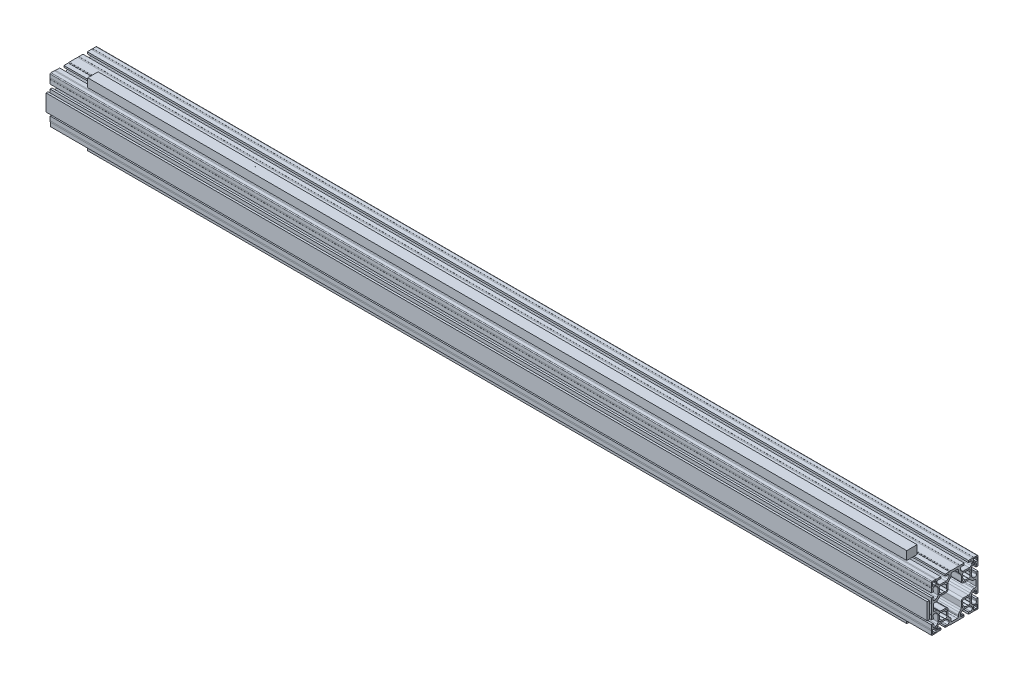
from build123d import *

# Parameters (mm, degrees)
ESQUISSE1_W             = 4
ESQUISSE1_H             = 32
BOSS_EXTRU_1_DEPTH      = 1700
BOSS_EXTRU_1_2_DEPTH    = 1700
ESQUISSE2_W             = 20
ESQUISSE2_H             = 16.5
ENL_V_MAT_EXTRU_1_DEPTH = 60
ESQUISSE3_W             = 20
ESQUISSE3_H             = 16.5
ENL_V_MAT_EXTRU_2_DEPTH = 60


with BuildPart() as part:
    # Esquisse1 → Boss.-Extru.1 (new body)
    with BuildSketch(Plane.ZY):
        with Locations((-16.500000003, -1e-08)):
            Rectangle(ESQUISSE1_W, ESQUISSE1_H)
    extrude(amount=BOSS_EXTRU_1_DEPTH)


with BuildPart() as body_2:
    # Esquisse1 → Boss.-Extru.1 2 (new body)
    with BuildSketch(Plane.ZY):
        with BuildLine():
            Line((-35.000000052, -61.000000011), (-35.000000052, -44.500000011))
            Line((-35.000000052, -44.500000011), (-32.499899985, -44.500000011))
            Line((-32.499899985, -44.500000011), (-32.499899985, -44.850000011))
            Line((-32.499899985, -44.850000011), (-30.499999985, -44.850000011))
            Line((-30.499999985, -44.850000011), (-30.499999985, -45.000000035))
            Line((-30.499999985, -45.000000035), (-23.999999985, -45.000000035))
            ThreePointArc((-23.999999985, -45.000000035), (-23.46492799, -44.901320113), (-23.000257146, -44.618263983))
            Line((-23.000257146, -44.618263983), (-23.000257146, -37.000000035))
            Line((-23.000257146, -37.000000035), (-22.649999985, -37.000000035))
            Line((-22.649999985, -37.000000035), (-22.649999985, -34.500000035))
            Line((-22.649999985, -34.500000035), (-22.499999985, -34.500000035))
            Line((-22.499999985, -34.500000035), (-22.499999985, -26.600000035))
            Line((-22.499999985, -26.600000035), (-26.200199985, -26.600000035))
            Line((-26.200199985, -26.600000035), (-26.200199985, -29.075000035))
            Line((-26.200199985, -29.075000035), (-26.000199985, -29.075000035))
            ThreePointArc((-26.000199985, -29.075000035), (-25.646646594, -29.221446645), (-25.500199985, -29.575000035))
            Line((-25.500199985, -29.575000035), (-25.500199985, -31.000000035))
            ThreePointArc((-25.500199985, -31.000000035), (-26.378879641, -33.121320379), (-28.500199985, -34.000000035))
            Line((-28.500199985, -34.000000035), (-30.550299985, -34.000000035))
            ThreePointArc((-30.550299985, -34.000000035), (-31.315632123, -33.847773485), (-31.964449526, -33.414250496))
            Line((-31.964449526, -33.414250496), (-33.735599986, -31.643100036))
            ThreePointArc((-33.735599986, -31.643100036), (-34.819416002, -30.020972887), (-35.199999986, -28.107570295))
            Line((-35.199999986, -28.107570295), (-35.199999986, -16.892400036))
            ThreePointArc((-35.199999986, -16.892400036), (-34.819300524, -14.978748396), (-33.735254217, -13.356454253))
            Line((-33.735254217, -13.356454253), (-31.964500003, -11.585800019))
            ThreePointArc((-31.964500003, -11.585800019), (-31.315676681, -11.152245019), (-30.550325061, -11.000000019))
            Line((-30.550325061, -11.000000019), (-28.500200003, -11.000000019))
            ThreePointArc((-28.500200003, -11.000000019), (-26.378879659, -11.878679675), (-25.500200003, -14.000000019))
            Line((-25.500200003, -14.000000019), (-25.500200003, -15.425000019))
            ThreePointArc((-25.500200003, -15.425000019), (-25.646646612, -15.77855341), (-26.000200003, -15.925000019))
            Line((-26.000200003, -15.925000019), (-26.200200003, -15.925000019))
            Line((-26.200200003, -15.925000019), (-26.200200003, -18.400000019))
            Line((-26.200200003, -18.400000019), (-22.500000003, -18.400000019))
            Line((-22.500000003, -18.400000019), (-22.500000003, -10.500000019))
            Line((-22.500000003, -10.500000019), (-22.650000003, -10.500000019))
            Line((-22.650000003, -10.500000019), (-22.650000003, -8.000000019))
            Line((-22.650000003, -8.000000019), (-22.500000003, -8.000000019))
            Line((-22.500000003, -8.000000019), (-22.500000003, 7.999999981))
            Line((-22.500000003, 7.999999981), (-22.650000003, 7.999999981))
            Line((-22.650000003, 7.999999981), (-22.650000003, 10.499999981))
            Line((-22.650000003, 10.499999981), (-22.500000003, 10.499999981))
            Line((-22.500000003, 10.499999981), (-22.500000003, 18.399999981))
            Line((-22.500000003, 18.399999981), (-26.200200003, 18.399999981))
            Line((-26.200200003, 18.399999981), (-26.200200003, 15.924999981))
            Line((-26.200200003, 15.924999981), (-26.000200003, 15.924999981))
            ThreePointArc((-26.000200003, 15.924999981), (-25.646646612, 15.778553372), (-25.500200003, 15.424999981))
            Line((-25.500200003, 15.424999981), (-25.500200003, 13.999999981))
            ThreePointArc((-25.500200003, 13.999999981), (-26.378879659, 11.878679637), (-28.500200003, 10.999999981))
            Line((-28.500200003, 10.999999981), (-30.550300003, 10.999999981))
            ThreePointArc((-30.550300003, 10.999999981), (-31.31560606, 11.152215729), (-31.96440962, 11.585709598))
            Line((-31.96440962, 11.585709598), (-33.735600006, 13.356799978))
            ThreePointArc((-33.735600006, 13.356799978), (-34.819417479, 14.979030648), (-35.200000007, 16.892522118))
            Line((-35.200000007, 16.892522118), (-35.200000007, 28.107599978))
            ThreePointArc((-35.200000007, 28.107599978), (-34.819380598, 30.021058356), (-33.73549012, 31.643209868))
            Line((-33.73549012, 31.643209868), (-31.964500009, 33.41419998))
            ThreePointArc((-31.964500009, 33.41419998), (-31.315676687, 33.84775498), (-30.550325067, 33.99999998))
            Line((-30.550325067, 33.99999998), (-28.500200009, 33.99999998))
            ThreePointArc((-28.500200009, 33.99999998), (-26.378879665, 33.121320324), (-25.500200009, 30.99999998))
            Line((-25.500200009, 30.99999998), (-25.500200009, 29.57499998))
            ThreePointArc((-25.500200009, 29.57499998), (-25.646646618, 29.221446589), (-26.000200009, 29.07499998))
            Line((-26.000200009, 29.07499998), (-26.200200009, 29.07499998))
            Line((-26.200200009, 29.07499998), (-26.200200009, 26.59999998))
            Line((-26.200200009, 26.59999998), (-22.500000009, 26.59999998))
            Line((-22.500000009, 26.59999998), (-22.500000009, 34.49999998))
            Line((-22.500000009, 34.49999998), (-22.650000009, 34.49999998))
            Line((-22.650000009, 34.49999998), (-22.650000009, 36.99999998))
            Line((-22.650000009, 36.99999998), (-22.495270583, 36.99999998))
            Line((-22.495270583, 36.99999998), (-22.495270583, 43.500000016))
            ThreePointArc((-22.495270583, 43.500000016), (-22.934610411, 44.560660188), (-23.995270583, 45.000000016))
            Line((-23.995270583, 45.000000016), (-30.500000009, 45.000000016))
            Line((-30.500000009, 45.000000016), (-30.500000009, 44.850000016))
            Line((-30.500000009, 44.850000016), (-32.499900009, 44.850000016))
            Line((-32.499900009, 44.850000016), (-32.499900009, 44.500000016))
            Line((-32.499900009, 44.500000016), (-35.000000031, 44.500000016))
            Line((-35.000000031, 44.500000016), (-35.000000031, 61.000000016))
            Line((-35.000000031, 61.000000016), (-55.000000031, 61.000000016))
            Line((-55.000000031, 61.000000016), (-55.000000031, 44.500000016))
            Line((-55.000000031, 44.500000016), (-57.499900008, 44.500000016))
            Line((-57.499900008, 44.500000016), (-57.499900008, 44.850000016))
            Line((-57.499900008, 44.850000016), (-59.500000008, 44.850000016))
            Line((-59.500000008, 44.850000016), (-59.500000008, 45.000000016))
            Line((-59.500000008, 45.000000016), (-75.500000008, 45.000000016))
            Line((-75.500000008, 45.000000016), (-75.500000008, 44.850000016))
            Line((-75.500000008, 44.850000016), (-78.000000008, 44.850000016))
            Line((-78.000000008, 44.850000016), (-78.000000008, 45.000000016))
            Line((-78.000000008, 45.000000016), (-85.900000008, 45.000000016))
            Line((-85.900000008, 45.000000016), (-85.900000008, 41.299800016))
            Line((-85.900000008, 41.299800016), (-83.425000008, 41.299800016))
            Line((-83.425000008, 41.299800016), (-83.425000008, 41.499799922))
            ThreePointArc((-83.425000008, 41.499799922), (-83.278553431, 41.853353373), (-82.925000008, 41.999800016))
            Line((-82.925000008, 41.999800016), (-81.500000008, 41.999800016))
            ThreePointArc((-81.500000008, 41.999800016), (-79.378679664, 41.121120359), (-78.500000008, 38.999800016))
            Line((-78.500000008, 38.999800016), (-78.500000008, 36.949700016))
            ThreePointArc((-78.500000008, 36.949700016), (-78.652226558, 36.184367878), (-79.085749547, 35.535550474))
            Line((-79.085749547, 35.535550474), (-80.856900007, 33.764400015))
            ThreePointArc((-80.856900007, 33.764400015), (-82.479027156, 32.680583999), (-84.392429748, 32.300000015))
            Line((-84.392429748, 32.300000015), (-95.607600007, 32.300000015))
            ThreePointArc((-95.607600007, 32.300000015), (-97.521251647, 32.680699477), (-99.14354579, 33.764745784))
            Line((-99.14354579, 33.764745784), (-100.914200024, 35.535499998))
            ThreePointArc((-100.914200024, 35.535499998), (-101.347755024, 36.18432332), (-101.500000024, 36.949674939))
            Line((-101.500000024, 36.949674939), (-101.500000024, 38.999799998))
            ThreePointArc((-101.500000024, 38.999799998), (-100.621320368, 41.121120341), (-98.500000024, 41.999799998))
            Line((-98.500000024, 41.999799998), (-97.075000024, 41.999799998))
            ThreePointArc((-97.075000024, 41.999799998), (-96.721446633, 41.853353388), (-96.575000024, 41.499799998))
            Line((-96.575000024, 41.499799998), (-96.575000024, 41.299799998))
            Line((-96.575000024, 41.299799998), (-94.100000024, 41.299799998))
            Line((-94.100000024, 41.299799998), (-94.100000024, 44.999999998))
            Line((-94.100000024, 44.999999998), (-102.000000024, 44.999999998))
            Line((-102.000000024, 44.999999998), (-102.000000024, 44.849999998))
            Line((-102.000000024, 44.849999998), (-104.500000024, 44.849999998))
            Line((-104.500000024, 44.849999998), (-104.500000024, 44.999999998))
            Line((-104.500000024, 44.999999998), (-111.000000024, 44.999999998))
            ThreePointArc((-111.000000024, 44.999999998), (-112.060660196, 44.56066017), (-112.500000024, 43.499999998))
            Line((-112.500000024, 43.499999998), (-112.500000024, 36.999999998))
            Line((-112.500000024, 36.999999998), (-112.350000024, 36.999999998))
            Line((-112.350000024, 36.999999998), (-112.350000024, 34.499999998))
            Line((-112.350000024, 34.499999998), (-112.500000024, 34.499999998))
            Line((-112.500000024, 34.499999998), (-112.500000024, 26.599999998))
            Line((-112.500000024, 26.599999998), (-108.799800024, 26.599999998))
            Line((-108.799800024, 26.599999998), (-108.799800024, 29.074999998))
            Line((-108.799800024, 29.074999998), (-108.999800024, 29.074999998))
            ThreePointArc((-108.999800024, 29.074999998), (-109.353353415, 29.221446607), (-109.499800024, 29.574999998))
            Line((-109.499800024, 29.574999998), (-109.499800024, 30.999999998))
            ThreePointArc((-109.499800024, 30.999999998), (-108.621120368, 33.121320341), (-106.499800024, 33.999999998))
            Line((-106.499800024, 33.999999998), (-104.449700024, 33.999999998))
            ThreePointArc((-104.449700024, 33.999999998), (-103.684367886, 33.847773447), (-103.035550483, 33.414250458))
            Line((-103.035550483, 33.414250458), (-101.264400023, 31.643099999))
            ThreePointArc((-101.264400023, 31.643099999), (-100.180584007, 30.020972849), (-99.800000023, 28.107570258))
            Line((-99.800000023, 28.107570258), (-99.800000023, 16.892399999))
            ThreePointArc((-99.800000023, 16.892399999), (-100.180699485, 14.978748358), (-101.264745792, 13.356454216))
            Line((-101.264745792, 13.356454216), (-103.035500006, 11.585799982))
            ThreePointArc((-103.035500006, 11.585799982), (-103.684323328, 11.152244982), (-104.449674948, 10.999999982))
            Line((-104.449674948, 10.999999982), (-106.499800006, 10.999999982))
            ThreePointArc((-106.499800006, 10.999999982), (-108.62112035, 11.878679638), (-109.499800006, 13.999999982))
            Line((-109.499800006, 13.999999982), (-109.499800006, 15.424999982))
            ThreePointArc((-109.499800006, 15.424999982), (-109.353353397, 15.778553372), (-108.999800006, 15.924999982))
            Line((-108.999800006, 15.924999982), (-108.799800006, 15.924999982))
            Line((-108.799800006, 15.924999982), (-108.799800006, 18.399999982))
            Line((-108.799800006, 18.399999982), (-112.500000006, 18.399999982))
            Line((-112.500000006, 18.399999982), (-112.500000006, 10.499999982))
            Line((-112.500000006, 10.499999982), (-112.350000006, 10.499999982))
            Line((-112.350000006, 10.499999982), (-112.350000006, 7.999999982))
            Line((-112.350000006, 7.999999982), (-112.500000006, 7.999999982))
            Line((-112.500000006, 7.999999982), (-112.500000006, -8.000000018))
            Line((-112.500000006, -8.000000018), (-112.350000006, -8.000000018))
            Line((-112.350000006, -8.000000018), (-112.350000006, -10.500000018))
            Line((-112.350000006, -10.500000018), (-112.500000006, -10.500000018))
            Line((-112.500000006, -10.500000018), (-112.500000006, -18.400000018))
            Line((-112.500000006, -18.400000018), (-108.799800006, -18.400000018))
            Line((-108.799800006, -18.400000018), (-108.799800006, -15.925000018))
            Line((-108.799800006, -15.925000018), (-108.999800006, -15.925000018))
            ThreePointArc((-108.999800006, -15.925000018), (-109.353353397, -15.778553409), (-109.499800006, -15.425000018))
            Line((-109.499800006, -15.425000018), (-109.499800006, -14.000000018))
            ThreePointArc((-109.499800006, -14.000000018), (-108.62112035, -11.878679675), (-106.499800006, -11.000000018))
            Line((-106.499800006, -11.000000018), (-104.449700006, -11.000000018))
            ThreePointArc((-104.449700006, -11.000000018), (-103.684393949, -11.152215766), (-103.035590389, -11.585709635))
            Line((-103.035590389, -11.585709635), (-101.264400003, -13.356800015))
            ThreePointArc((-101.264400003, -13.356800015), (-100.18058253, -14.979030686), (-99.800000002, -16.892522155))
            Line((-99.800000002, -16.892522155), (-99.800000002, -28.107600015))
            ThreePointArc((-99.800000002, -28.107600015), (-100.180619411, -30.021058393), (-101.264509889, -31.643209906))
            Line((-101.264509889, -31.643209906), (-103.0355, -33.414200017))
            ThreePointArc((-103.0355, -33.414200017), (-103.684323322, -33.847755017), (-104.449674941, -34.000000017))
            Line((-104.449674941, -34.000000017), (-106.4998, -34.000000017))
            ThreePointArc((-106.4998, -34.000000017), (-108.621120344, -33.121320361), (-109.4998, -31.000000017))
            Line((-109.4998, -31.000000017), (-109.4998, -29.575000017))
            ThreePointArc((-109.4998, -29.575000017), (-109.353353391, -29.221446627), (-108.9998, -29.075000017))
            Line((-108.9998, -29.075000017), (-108.7998, -29.075000017))
            Line((-108.7998, -29.075000017), (-108.7998, -26.600000017))
            Line((-108.7998, -26.600000017), (-112.5, -26.600000017))
            Line((-112.5, -26.600000017), (-112.5, -34.500000017))
            Line((-112.5, -34.500000017), (-112.35, -34.500000017))
            Line((-112.35, -34.500000017), (-112.35, -37.000000017))
            Line((-112.35, -37.000000017), (-112.5, -37.000000017))
            Line((-112.5, -37.000000017), (-112.5, -43.500000017))
            ThreePointArc((-112.5, -43.500000017), (-112.060660172, -44.560660189), (-111, -45.000000017))
            Line((-111, -45.000000017), (-104.5, -45.000000017))
            Line((-104.5, -45.000000017), (-104.5, -44.850000017))
            Line((-104.5, -44.850000017), (-102, -44.850000017))
            Line((-102, -44.850000017), (-102, -45.000000017))
            Line((-102, -45.000000017), (-94.1, -45.000000017))
            Line((-94.1, -45.000000017), (-94.1, -41.299800017))
            Line((-94.1, -41.299800017), (-96.575, -41.299800017))
            Line((-96.575, -41.299800017), (-96.575, -41.499800017))
            ThreePointArc((-96.575, -41.499800017), (-96.721446609, -41.853353408), (-97.075, -41.999800017))
            Line((-97.075, -41.999800017), (-98.5, -41.999800017))
            ThreePointArc((-98.5, -41.999800017), (-100.621320344, -41.121120361), (-101.5, -38.999800017))
            Line((-101.5, -38.999800017), (-101.5, -36.949700017))
            ThreePointArc((-101.5, -36.949700017), (-101.347784252, -36.18439396), (-100.914290383, -35.5355904))
            Line((-100.914290383, -35.5355904), (-99.143200003, -33.764400014))
            ThreePointArc((-99.143200003, -33.764400014), (-97.520969333, -32.680582541), (-95.607477863, -32.300000013))
            Line((-95.607477863, -32.300000013), (-84.392400003, -32.300000013))
            ThreePointArc((-84.392400003, -32.300000013), (-82.478941625, -32.680619422), (-80.856790113, -33.7645099))
            Line((-80.856790113, -33.7645099), (-79.085800001, -35.535500011))
            ThreePointArc((-79.085800001, -35.535500011), (-78.652245001, -36.184323333), (-78.500000001, -36.949674953))
            Line((-78.500000001, -36.949674953), (-78.500000001, -38.999800011))
            ThreePointArc((-78.500000001, -38.999800011), (-79.378679657, -41.121120355), (-81.500000001, -41.999800011))
            Line((-81.500000001, -41.999800011), (-82.925000001, -41.999800011))
            ThreePointArc((-82.925000001, -41.999800011), (-83.278553392, -41.853353402), (-83.425000001, -41.499800011))
            Line((-83.425000001, -41.499800011), (-83.425000001, -41.299800011))
            Line((-83.425000001, -41.299800011), (-85.900000001, -41.299800011))
            Line((-85.900000001, -41.299800011), (-85.900000001, -45.000000011))
            Line((-85.900000001, -45.000000011), (-78.000000001, -45.000000011))
            Line((-78.000000001, -45.000000011), (-78.000000001, -44.850000011))
            Line((-78.000000001, -44.850000011), (-75.500000001, -44.850000011))
            Line((-75.500000001, -44.850000011), (-75.500000001, -45.000000011))
            Line((-75.500000001, -45.000000011), (-59.500000001, -45.000000011))
            Line((-59.500000001, -45.000000011), (-59.500000001, -44.850000011))
            Line((-59.500000001, -44.850000011), (-57.499900001, -44.850000011))
            Line((-57.499900001, -44.850000011), (-57.499900001, -44.500000011))
            Line((-57.499900001, -44.500000011), (-55.000000052, -44.500000011))
            Line((-55.000000052, -44.500000011), (-55.000000052, -61.000000011))
            Line((-55.000000052, -61.000000011), (-35.000000052, -61.000000011))
        make_face()
        with BuildLine():
            Line((-29.076642797, 42.724999998), (-29.528973228, 42.724999998))
            ThreePointArc((-29.528973228, 42.724999998), (-29.541768317, 42.736749448), (-29.553862202, 42.749219485))
            ThreePointArc((-29.553862202, 42.749219485), (-31.288081889, 42.787974404), (-31.249107346, 41.053759639))
            ThreePointArc((-31.249107346, 41.053759639), (-31.23664393, 41.041687027), (-31.224900024, 41.028913406))
            Line((-31.224900024, 41.028913406), (-31.224900024, 40.576742771))
            ThreePointArc((-31.224900024, 40.576742771), (-31.399900024, 39.499999998), (-31.224900024, 38.423257224))
            Line((-31.224900024, 38.423257224), (-31.224900024, 37.971086516))
            ThreePointArc((-31.224900024, 37.971086516), (-31.236696947, 37.958258497), (-31.249219512, 37.94613782))
            ThreePointArc((-31.249219512, 37.94613782), (-31.288028161, 36.21197186), (-29.553862202, 36.25078051))
            ThreePointArc((-29.553862202, 36.25078051), (-29.54176832, 36.263250544), (-29.528973235, 36.274999992))
            Line((-29.528973235, 36.274999992), (-29.0766428, 36.274999992))
            ThreePointArc((-29.0766428, 36.274999992), (-27.999900025, 36.099999992), (-26.923157251, 36.274999991))
            Line((-26.923157251, 36.274999991), (-26.470826875, 36.274999991))
            ThreePointArc((-26.470826875, 36.274999991), (-26.458031774, 36.263250531), (-26.445937878, 36.250780484))
            ThreePointArc((-26.445937878, 36.250780484), (-24.711718185, 36.212025565), (-24.750692728, 37.946240336))
            ThreePointArc((-24.750692728, 37.946240336), (-24.763156122, 37.958312925), (-24.774900008, 37.971086519))
            Line((-24.774900008, 37.971086519), (-24.774900008, 38.423257227))
            ThreePointArc((-24.774900008, 38.423257227), (-24.599900009, 39.500000001), (-24.774900008, 40.576742774))
            Line((-24.774900008, 40.576742774), (-24.774900008, 41.028913463))
            ThreePointArc((-24.774900008, 41.028913463), (-24.763103082, 41.04174148), (-24.750580515, 41.053862156))
            ThreePointArc((-24.750580515, 41.053862156), (-24.711729908, 42.787986157), (-26.445857743, 42.749307047))
            ThreePointArc((-26.445857743, 42.749307047), (-26.457989209, 42.736790834), (-26.47082682, 42.724999998))
            Line((-26.47082682, 42.724999998), (-26.923157251, 42.724999998))
            ThreePointArc((-26.923157251, 42.724999998), (-27.999900024, 42.899999998), (-29.076642797, 42.724999998))
        make_face(mode=Mode.SUBTRACT)
        with BuildLine():
            Line((-44.999352446, -15.499999994), (-45.000647557, -15.499999994))
            ThreePointArc((-45.000647557, -15.499999994), (-46.371401346, -15.63565306), (-47.689052021, -16.037105925))
            ThreePointArc((-47.689052021, -16.037105925), (-47.873801051, -16.04900499), (-48.030362859, -15.950201184))
            ThreePointArc((-48.030362859, -15.950201184), (-51.720257272, -15.781423325), (-51.550684962, -19.471281313))
            ThreePointArc((-51.550684962, -19.471281313), (-51.451227176, -19.630065931), (-51.465364645, -19.816893494))
            ThreePointArc((-51.465364645, -19.816893494), (-52.000000025, -22.499958968), (-51.465396072, -25.183030705))
            ThreePointArc((-51.465396072, -25.183030705), (-51.451213895, -25.369880137), (-51.550662699, -25.528700097))
            ThreePointArc((-51.550662699, -25.528700097), (-51.720297792, -29.218536088), (-48.030417628, -29.049864568))
            ThreePointArc((-48.030417628, -29.049864568), (-47.873843079, -28.951005636), (-47.68905305, -28.962893575))
            ThreePointArc((-47.68905305, -28.962893575), (-45.000000154, -29.499999964), (-42.310947238, -28.962893674))
            ThreePointArc((-42.310947238, -28.962893674), (-42.126157098, -28.951005611), (-41.969582427, -29.049864574))
            ThreePointArc((-41.969582427, -29.049864574), (-38.279712507, -29.218546325), (-38.449315088, -25.528718615))
            ThreePointArc((-38.449315088, -25.528718615), (-38.548772874, -25.369933997), (-38.534635405, -25.183106435))
            ThreePointArc((-38.534635405, -25.183106435), (-38.000000025, -22.500000219), (-38.53463521, -19.816893964))
            ThreePointArc((-38.53463521, -19.816893964), (-38.548772935, -19.630066179), (-38.449315088, -19.471281313))
            ThreePointArc((-38.449315088, -19.471281313), (-38.279712501, -15.78145361), (-41.969582416, -15.950135341))
            ThreePointArc((-41.969582416, -15.950135341), (-42.126157633, -16.048994442), (-42.310948274, -16.037105823))
            ThreePointArc((-42.310948274, -16.037105823), (-43.628598811, -15.635653039), (-44.999352446, -15.499999994))
        make_face(mode=Mode.SUBTRACT)
        with BuildLine():
            Line((-29.076642797, -36.275000002), (-29.528973228, -36.275000002))
            ThreePointArc((-29.528973228, -36.275000002), (-29.541768317, -36.263250552), (-29.553862202, -36.250780515))
            ThreePointArc((-29.553862202, -36.250780515), (-31.288028161, -36.211971865), (-31.249219512, -37.946137824))
            ThreePointArc((-31.249219512, -37.946137824), (-31.236696947, -37.958258502), (-31.224900024, -37.971086521))
            Line((-31.224900024, -37.971086521), (-31.224900024, -38.423257229))
            ThreePointArc((-31.224900024, -38.423257229), (-31.399900024, -39.500000002), (-31.224900024, -40.576742776))
            Line((-31.224900024, -40.576742776), (-31.224900024, -41.028913484))
            ThreePointArc((-31.224900024, -41.028913484), (-31.236696947, -41.041741503), (-31.249219512, -41.05386218))
            ThreePointArc((-31.249219512, -41.05386218), (-31.288028161, -42.78802814), (-29.553862202, -42.74921949))
            ThreePointArc((-29.553862202, -42.74921949), (-29.541768317, -42.736749453), (-29.528973228, -42.725000002))
            Line((-29.528973228, -42.725000002), (-29.076642797, -42.725000002))
            ThreePointArc((-29.076642797, -42.725000002), (-27.999900024, -42.900000002), (-26.923157251, -42.725000002))
            Line((-26.923157251, -42.725000002), (-26.47082682, -42.725000002))
            ThreePointArc((-26.47082682, -42.725000002), (-26.458031731, -42.736749453), (-26.445937846, -42.74921949))
            ThreePointArc((-26.445937846, -42.74921949), (-24.711771887, -42.78802814), (-24.750580536, -41.05386218))
            ThreePointArc((-24.750580536, -41.05386218), (-24.763103101, -41.041741503), (-24.774900024, -41.028913484))
            Line((-24.774900024, -41.028913484), (-24.774900024, -40.576742776))
            ThreePointArc((-24.774900024, -40.576742776), (-24.599900024, -39.500000002), (-24.774900024, -38.423257229))
            Line((-24.774900024, -38.423257229), (-24.774900024, -37.971086521))
            ThreePointArc((-24.774900024, -37.971086521), (-24.763103101, -37.958258502), (-24.750580536, -37.946137824))
            ThreePointArc((-24.750580536, -37.946137824), (-24.711771887, -36.211971865), (-26.445937846, -36.250780515))
            ThreePointArc((-26.445937846, -36.250780515), (-26.458031731, -36.263250552), (-26.47082682, -36.275000002))
            Line((-26.47082682, -36.275000002), (-26.923157251, -36.275000002))
            ThreePointArc((-26.923157251, -36.275000002), (-27.999900024, -36.100000002), (-29.076642797, -36.275000002))
        make_face(mode=Mode.SUBTRACT)
        with BuildLine():
            Line((-26.500000023, -5.000000001), (-26.500000023, 4.999999999))
            ThreePointArc((-26.500000023, 4.999999999), (-27.08578646, 6.414213561), (-28.500000023, 6.999999999))
            Line((-28.500000023, 6.999999999), (-30.964470282, 6.999999999))
            ThreePointArc((-30.964470282, 6.999999999), (-32.877872873, 7.380583982), (-34.500000023, 8.464399999))
            Line((-34.500000023, 8.464399999), (-37.271226172, 11.235626148))
            ThreePointArc((-37.271226172, 11.235626148), (-38.89326968, 12.31943362), (-40.806600025, 12.699999996))
            Line((-40.806600025, 12.699999996), (-50.800000025, 12.699999996))
            ThreePointArc((-50.800000025, 12.699999996), (-53.62842715, 13.871572872), (-54.800000025, 16.699999996))
            Line((-54.800000025, 16.699999996), (-54.800000025, 26.693462643))
            ThreePointArc((-54.800000025, 26.693462643), (-55.180612525, 28.606841691), (-56.264500025, 30.228899996))
            Line((-56.264500025, 30.228899996), (-58.742748354, 32.707208327))
            ThreePointArc((-58.742748354, 32.707208327), (-60.043313058, 34.653685927), (-60.500000024, 36.949699998))
            Line((-60.500000024, 36.949699998), (-60.500000024, 38.999999998))
            ThreePointArc((-60.500000024, 38.999999998), (-61.085786462, 40.41421356), (-62.500000024, 40.999999998))
            Line((-62.500000024, 40.999999998), (-72.500000024, 40.999999998))
            ThreePointArc((-72.500000024, 40.999999998), (-73.914213586, 40.41421356), (-74.500000024, 38.999999998))
            Line((-74.500000024, 38.999999998), (-74.500000024, 36.949699998))
            ThreePointArc((-74.500000024, 36.949699998), (-74.95668699, 34.653685927), (-76.257251694, 32.707208327))
            Line((-76.257251694, 32.707208327), (-78.735500023, 30.228899996))
            ThreePointArc((-78.735500023, 30.228899996), (-79.819387523, 28.606841691), (-80.200000023, 26.693462643))
            Line((-80.200000023, 26.693462643), (-80.200000023, 16.699999996))
            ThreePointArc((-80.200000023, 16.699999996), (-81.371572898, 13.871572872), (-84.200000023, 12.699999996))
            Line((-84.200000023, 12.699999996), (-94.193462669, 12.699999996))
            ThreePointArc((-94.193462669, 12.699999996), (-96.106841718, 12.319387496), (-97.728900023, 11.235499996))
            Line((-97.728900023, 11.235499996), (-100.499890134, 8.464509885))
            ThreePointArc((-100.499890134, 8.464509885), (-102.122041647, 7.380619407), (-104.035500025, 6.999999998))
            Line((-104.035500025, 6.999999998), (-106.500000025, 6.999999998))
            ThreePointArc((-106.500000025, 6.999999998), (-107.914213587, 6.41421356), (-108.500000025, 4.999999998))
            Line((-108.500000025, 4.999999998), (-108.500000025, -5.000000002))
            ThreePointArc((-108.500000025, -5.000000002), (-107.914213587, -6.414213565), (-106.500000025, -7.000000002))
            Line((-106.500000025, -7.000000002), (-104.035500025, -7.000000002))
            ThreePointArc((-104.035500025, -7.000000002), (-102.122041647, -7.380619412), (-100.499890134, -8.464509889))
            Line((-100.499890134, -8.464509889), (-97.728900023, -11.235500001))
            ThreePointArc((-97.728900023, -11.235500001), (-96.106841718, -12.319387501), (-94.193462669, -12.700000001))
            Line((-94.193462669, -12.700000001), (-84.200000023, -12.700000001))
            ThreePointArc((-84.200000023, -12.700000001), (-81.371572898, -13.871572876), (-80.200000023, -16.700000001))
            Line((-80.200000023, -16.700000001), (-80.200000023, -26.693462647))
            ThreePointArc((-80.200000023, -26.693462647), (-79.819387523, -28.606841696), (-78.735500023, -30.228900001))
            Line((-78.735500023, -30.228900001), (-76.257251694, -32.707208332))
            ThreePointArc((-76.257251694, -32.707208332), (-74.95668699, -34.653685932), (-74.500000024, -36.949700002))
            Line((-74.500000024, -36.949700002), (-74.500000024, -39.000000002))
            ThreePointArc((-74.500000024, -39.000000002), (-73.914213586, -40.414213565), (-72.500000024, -41.000000002))
            Line((-72.500000024, -41.000000002), (-62.500000023, -41.000000002))
            ThreePointArc((-62.500000023, -41.000000002), (-61.08578646, -40.414213564), (-60.500000023, -39.000000001))
            Line((-60.500000023, -39.000000001), (-60.500000023, -36.949661777))
            ThreePointArc((-60.500000023, -36.949661777), (-60.043276429, -34.653597504), (-58.742640023, -32.707100001))
            Line((-58.742640023, -32.707100001), (-56.264331078, -30.228731053))
            ThreePointArc((-56.264331078, -30.228731053), (-55.180554823, -28.606702384), (-54.800000027, -26.693399997))
            Line((-54.800000027, -26.693399997), (-54.800000027, -16.699999997))
            ThreePointArc((-54.800000027, -16.699999997), (-53.628427151, -13.871572873), (-50.800000027, -12.699999997))
            Line((-50.800000027, -12.699999997), (-40.806600027, -12.699999997))
            ThreePointArc((-40.806600027, -12.699999997), (-38.893269681, -12.319433621), (-37.271226173, -11.235626149))
            Line((-37.271226173, -11.235626149), (-34.500109913, -8.464509888))
            ThreePointArc((-34.500109913, -8.464509888), (-32.8779584, -7.380619411), (-30.964500023, -7.000000001))
            Line((-30.964500023, -7.000000001), (-28.500000023, -7.000000001))
            ThreePointArc((-28.500000023, -7.000000001), (-27.08578646, -6.414213564), (-26.500000023, -5.000000001))
        make_face(mode=Mode.SUBTRACT)
        with BuildLine():
            Line((-40.899999985, -44.500000011), (-49.100000001, -44.500000011))
            Line((-49.100000001, -44.500000011), (-49.100000001, -41.299800011))
            Line((-49.100000001, -41.299800011), (-51.575000001, -41.299800011))
            Line((-51.575000001, -41.299800011), (-51.575000001, -41.499800011))
            ThreePointArc((-51.575000001, -41.499800011), (-51.72144661, -41.853353402), (-52.075000001, -41.999800011))
            Line((-52.075000001, -41.999800011), (-53.500000001, -41.999800011))
            ThreePointArc((-53.500000001, -41.999800011), (-55.621320345, -41.121120355), (-56.500000001, -38.999800011))
            Line((-56.500000001, -38.999800011), (-56.500000001, -36.949700011))
            ThreePointArc((-56.500000001, -36.949700011), (-56.34777345, -36.184367873), (-55.914250462, -35.53555047))
            Line((-55.914250462, -35.53555047), (-54.143100002, -33.76440001))
            ThreePointArc((-54.143100002, -33.76440001), (-52.520972852, -32.680583994), (-50.607570261, -32.30000001))
            Line((-50.607570261, -32.30000001), (-39.392400002, -32.30000001))
            ThreePointArc((-39.392400002, -32.30000001), (-37.478748361, -32.680699472), (-35.856454219, -33.764745779))
            Line((-35.856454219, -33.764745779), (-34.085799985, -35.535499993))
            ThreePointArc((-34.085799985, -35.535499993), (-33.652244985, -36.184323315), (-33.499999985, -36.949674935))
            Line((-33.499999985, -36.949674935), (-33.499999985, -38.999799993))
            ThreePointArc((-33.499999985, -38.999799993), (-34.378679641, -41.121120337), (-36.499999985, -41.999799993))
            Line((-36.499999985, -41.999799993), (-37.924999985, -41.999799993))
            ThreePointArc((-37.924999985, -41.999799993), (-38.278553375, -41.853353384), (-38.424999985, -41.499799993))
            Line((-38.424999985, -41.499799993), (-38.424999985, -41.299800011))
            Line((-38.424999985, -41.299800011), (-40.899999985, -41.299800011))
            Line((-40.899999985, -41.299800011), (-40.899999985, -44.500000011))
        make_face(mode=Mode.SUBTRACT)
        with BuildLine():
            Line((-49.100000008, 44.499999998), (-40.900000009, 44.499999998))
            Line((-40.900000009, 44.499999998), (-40.900000009, 41.299799998))
            Line((-40.900000009, 41.299799998), (-38.425000009, 41.299799998))
            Line((-38.425000009, 41.299799998), (-38.425000009, 41.499800004))
            ThreePointArc((-38.425000009, 41.499800004), (-38.278553399, 41.853353395), (-37.925000009, 41.999800004))
            Line((-37.925000009, 41.999800004), (-36.500000009, 41.999800004))
            ThreePointArc((-36.500000009, 41.999800004), (-34.378679665, 41.121120347), (-33.500000009, 38.999800004))
            Line((-33.500000009, 38.999800004), (-33.500000009, 36.949700004))
            ThreePointArc((-33.500000009, 36.949700004), (-33.652215757, 36.184393947), (-34.085709626, 35.535590387))
            Line((-34.085709626, 35.535590387), (-35.856800006, 33.764400001))
            ThreePointArc((-35.856800006, 33.764400001), (-37.479030676, 32.680582527), (-39.392522146, 32.3))
            Line((-39.392522146, 32.3), (-50.607600006, 32.3))
            ThreePointArc((-50.607600006, 32.3), (-52.521058383, 32.680619409), (-54.143209896, 33.764509886))
            Line((-54.143209896, 33.764509886), (-55.914200008, 35.535499998))
            ThreePointArc((-55.914200008, 35.535499998), (-56.347755008, 36.18432332), (-56.500000008, 36.949674939))
            Line((-56.500000008, 36.949674939), (-56.500000008, 38.999799998))
            ThreePointArc((-56.500000008, 38.999799998), (-55.621320351, 41.121120341), (-53.500000008, 41.999799998))
            Line((-53.500000008, 41.999799998), (-52.075000008, 41.999799998))
            ThreePointArc((-52.075000008, 41.999799998), (-51.721446617, 41.853353388), (-51.575000008, 41.499799998))
            Line((-51.575000008, 41.499799998), (-51.575000008, 41.299799998))
            Line((-51.575000008, 41.299799998), (-49.100000008, 41.299799998))
            Line((-49.100000008, 41.299799998), (-49.100000008, 44.499999998))
        make_face(mode=Mode.SUBTRACT)
        with BuildLine():
            ThreePointArc((-87.310948458, -16.03710579), (-88.628787258, -15.635615434), (-90.000000574, -15.500000008))
            ThreePointArc((-90.000000574, -15.500000008), (-91.371213424, -15.635615556), (-92.68905179, -16.037105864))
            ThreePointArc((-92.68905179, -16.037105864), (-92.87384243, -16.048994481), (-93.030417644, -15.950135381))
            ThreePointArc((-93.030417644, -15.950135381), (-96.72028756, -15.781453649), (-96.550684972, -19.471281353))
            ThreePointArc((-96.550684972, -19.471281353), (-96.451227187, -19.630065971), (-96.465364655, -19.816893533))
            ThreePointArc((-96.465364655, -19.816893533), (-97.000000036, -22.499999749), (-96.465364851, -25.183106003))
            ThreePointArc((-96.465364851, -25.183106003), (-96.451227126, -25.369933789), (-96.550684973, -25.528718654))
            ThreePointArc((-96.550684973, -25.528718654), (-96.720287557, -29.21854636), (-93.030417639, -29.04986462))
            ThreePointArc((-93.030417639, -29.04986462), (-92.87384267, -28.951005582), (-92.689052256, -28.962893949))
            ThreePointArc((-92.689052256, -28.962893949), (-90.000000194, -29.500000003), (-87.310948107, -28.962894071))
            ThreePointArc((-87.310948107, -28.962894071), (-87.126199045, -28.95099497), (-86.969637201, -29.049798783))
            ThreePointArc((-86.969637201, -29.049798783), (-83.279742789, -29.218576642), (-83.449315099, -25.528718654))
            ThreePointArc((-83.449315099, -25.528718654), (-83.548772884, -25.369934036), (-83.534635416, -25.183106474))
            ThreePointArc((-83.534635416, -25.183106474), (-83.000000036, -22.500040999), (-83.534603989, -19.816969263))
            ThreePointArc((-83.534603989, -19.816969263), (-83.548786166, -19.63011983), (-83.449337361, -19.47129987))
            ThreePointArc((-83.449337361, -19.47129987), (-83.279732446, -15.781433694), (-86.969637027, -15.950201024))
            ThreePointArc((-86.969637027, -15.950201024), (-87.126199099, -16.049005051), (-87.310948458, -16.03710579))
        make_face(mode=Mode.SUBTRACT)
        with BuildLine():
            ThreePointArc((-42.310948458, 28.96289421), (-43.628787145, 29.364384544), (-45.000000025, 29.499999992))
            ThreePointArc((-45.000000025, 29.499999992), (-46.371212998, 29.364384529), (-47.68905179, 28.962894137))
            ThreePointArc((-47.68905179, 28.962894137), (-47.873842429, 28.951005519), (-48.030417644, 29.049864619))
            ThreePointArc((-48.030417644, 29.049864619), (-51.72028756, 29.218546351), (-51.550684972, 25.528718647))
            ThreePointArc((-51.550684972, 25.528718647), (-51.451227187, 25.369934029), (-51.465364655, 25.183106467))
            ThreePointArc((-51.465364655, 25.183106467), (-52.000000035, 22.500000251), (-51.465364851, 19.816893996))
            ThreePointArc((-51.465364851, 19.816893996), (-51.451227126, 19.630066211), (-51.550684973, 19.471281346))
            ThreePointArc((-51.550684973, 19.471281346), (-51.720257372, 15.781423448), (-48.030363033, 15.950201021))
            ThreePointArc((-48.030363033, 15.950201021), (-47.873801307, 16.049004962), (-47.689052265, 16.037106054))
            ThreePointArc((-47.689052265, 16.037106054), (-45.000000199, 15.499999997), (-42.310948109, 16.037105929))
            ThreePointArc((-42.310948109, 16.037105929), (-42.126199046, 16.049005031), (-41.969637201, 15.950201217))
            ThreePointArc((-41.969637201, 15.950201217), (-38.279742789, 15.781423358), (-38.449315099, 19.471281346))
            ThreePointArc((-38.449315099, 19.471281346), (-38.548772884, 19.630065964), (-38.534635416, 19.816893526))
            ThreePointArc((-38.534635416, 19.816893526), (-38.000000036, 22.499959001), (-38.534603989, 25.183030737))
            ThreePointArc((-38.534603989, 25.183030737), (-38.548786166, 25.36988017), (-38.449337361, 25.52870013))
            ThreePointArc((-38.449337361, 25.52870013), (-38.279732446, 29.218566306), (-41.969637027, 29.049798976))
            ThreePointArc((-41.969637027, 29.049798976), (-42.126199099, 28.950994949), (-42.310948458, 28.96289421))
        make_face(mode=Mode.SUBTRACT)
        with BuildLine():
            ThreePointArc((-108.554062202, -36.250780515), (-110.288281889, -36.212025596), (-110.249307346, -37.946240361))
            ThreePointArc((-110.249307346, -37.946240361), (-110.159742819, -38.09892471), (-110.171951909, -38.275518178))
            ThreePointArc((-110.171951909, -38.275518178), (-110.400100056, -39.500000038), (-110.171951909, -40.724481897))
            ThreePointArc((-110.171951909, -40.724481897), (-110.159760206, -40.901149335), (-110.249419544, -41.053862216))
            ThreePointArc((-110.249419544, -41.053862216), (-110.288228194, -42.788028175), (-108.554062235, -42.749219525))
            ThreePointArc((-108.554062235, -42.749219525), (-108.401267519, -42.659664452), (-108.224581916, -42.67185189))
            ThreePointArc((-108.224581916, -42.67185189), (-107.000100056, -42.900000038), (-105.775618197, -42.67185189))
            ThreePointArc((-105.775618197, -42.67185189), (-105.598932585, -42.65966445), (-105.446137865, -42.74921953))
            ThreePointArc((-105.446137865, -42.74921953), (-103.711971906, -42.78802818), (-103.750780555, -41.053862221))
            ThreePointArc((-103.750780555, -41.053862221), (-103.840439893, -40.90114934), (-103.82824819, -40.724481903))
            ThreePointArc((-103.82824819, -40.724481903), (-103.600100042, -39.50000003), (-103.828248196, -38.275518158))
            ThreePointArc((-103.828248196, -38.275518158), (-103.840439899, -38.098850721), (-103.750780561, -37.94613784))
            ThreePointArc((-103.750780561, -37.94613784), (-103.711971911, -36.21197188), (-105.446137871, -36.25078053))
            ThreePointArc((-105.446137871, -36.25078053), (-105.598932586, -36.340335603), (-105.775618189, -36.328148165))
            ThreePointArc((-105.775618189, -36.328148165), (-107.000100035, -36.100000016), (-108.224581884, -36.32814815))
            ThreePointArc((-108.224581884, -36.32814815), (-108.401267487, -36.340335587), (-108.554062202, -36.250780515))
        make_face(mode=Mode.SUBTRACT)
        with BuildLine():
            ThreePointArc((-87.310948449, 28.962894219), (-88.628786767, 29.364384479), (-89.999998295, 29.5))
            ThreePointArc((-89.999998295, 29.5), (-91.371211778, 29.364384779), (-92.689052021, 28.962894045))
            ThreePointArc((-92.689052021, 28.962894045), (-92.873801051, 28.95099498), (-93.030362859, 29.049798785))
            ThreePointArc((-93.030362859, 29.049798785), (-96.720257272, 29.218576644), (-96.550684962, 25.528718656))
            ThreePointArc((-96.550684962, 25.528718656), (-96.451227176, 25.369934038), (-96.465364645, 25.183106476))
            ThreePointArc((-96.465364645, 25.183106476), (-97.000000025, 22.50000026), (-96.46536484, 19.816894005))
            ThreePointArc((-96.46536484, 19.816894005), (-96.451227115, 19.63006622), (-96.550684962, 19.471281355))
            ThreePointArc((-96.550684962, 19.471281355), (-96.720287545, 15.781453646), (-93.030417625, 15.950135393))
            ThreePointArc((-93.030417625, 15.950135393), (-92.873842831, 16.048994387), (-92.689052577, 16.037106197))
            ThreePointArc((-92.689052577, 16.037106197), (-90.000000313, 15.500000005), (-87.310948005, 16.037105976))
            ThreePointArc((-87.310948005, 16.037105976), (-87.126157494, 16.048994451), (-86.969582419, 15.950135386))
            ThreePointArc((-86.969582419, 15.950135386), (-83.279712502, 15.781453649), (-83.449315088, 19.471281355))
            ThreePointArc((-83.449315088, 19.471281355), (-83.548772874, 19.630065973), (-83.534635405, 19.816893535))
            ThreePointArc((-83.534635405, 19.816893535), (-83.000000025, 22.499959009), (-83.534603978, 25.183030746))
            ThreePointArc((-83.534603978, 25.183030746), (-83.548786155, 25.369880178), (-83.449337351, 25.528700138))
            ThreePointArc((-83.449337351, 25.528700138), (-83.279732436, 29.218566314), (-86.969637016, 29.049798984))
            ThreePointArc((-86.969637016, 29.049798984), (-87.126199089, 28.950994957), (-87.310948449, 28.962894219))
        make_face(mode=Mode.SUBTRACT)
        with BuildLine():
            ThreePointArc((-110.171951877, 40.724481858), (-110.400100024, 39.499948441), (-110.17191474, 38.275421944))
            ThreePointArc((-110.17191474, 38.275421944), (-110.159772, 38.098800507), (-110.24941953, 37.946137813))
            ThreePointArc((-110.24941953, 37.946137813), (-110.288270129, 36.212013805), (-108.554142288, 36.250692937))
            ThreePointArc((-108.554142288, 36.250692937), (-108.401325244, 36.340322002), (-108.224581884, 36.328148145))
            ThreePointArc((-108.224581884, 36.328148145), (-107.000100024, 36.099999998), (-105.775618164, 36.328148145))
            ThreePointArc((-105.775618164, 36.328148145), (-105.598932561, 36.340335583), (-105.446137846, 36.25078051))
            ThreePointArc((-105.446137846, 36.25078051), (-103.711971887, 36.21197186), (-103.750780536, 37.94613782))
            ThreePointArc((-103.750780536, 37.94613782), (-103.840439874, 38.098850701), (-103.828248171, 38.275518138))
            ThreePointArc((-103.828248171, 38.275518138), (-103.600100024, 39.499999998), (-103.828248171, 40.724481858))
            ThreePointArc((-103.828248171, 40.724481858), (-103.840439874, 40.901149295), (-103.750780536, 41.053862176))
            ThreePointArc((-103.750780536, 41.053862176), (-103.711971887, 42.788028135), (-105.446137846, 42.749219485))
            ThreePointArc((-105.446137846, 42.749219485), (-105.598932561, 42.659664413), (-105.775618164, 42.67185185))
            ThreePointArc((-105.775618164, 42.67185185), (-107.000100024, 42.899999998), (-108.224581884, 42.67185185))
            ThreePointArc((-108.224581884, 42.67185185), (-108.401267487, 42.659664413), (-108.554062202, 42.749219485))
            ThreePointArc((-108.554062202, 42.749219485), (-110.288228161, 42.788028135), (-110.249419512, 41.053862176))
            ThreePointArc((-110.249419512, 41.053862176), (-110.159760174, 40.901149295), (-110.171951877, 40.724481858))
        make_face(mode=Mode.SUBTRACT)
    extrude(amount=BOSS_EXTRU_1_2_DEPTH)

    # Esquisse2 → Enlèv. mat.-Extru.1 (cut)
    with BuildSketch(Plane(origin=(0, 0, 0), x_dir=(0, 0, -1), z_dir=(1, 0, 0))):
        with Locations((45.000000031, 52.750000016)):
            Rectangle(ESQUISSE2_W, ESQUISSE2_H)
        with Locations((45.000000052, -52.750000011)):
            Rectangle(ESQUISSE2_W, ESQUISSE2_H)
    extrude(amount=-ENL_V_MAT_EXTRU_1_DEPTH, mode=Mode.SUBTRACT)

    # Esquisse3 → Enlèv. mat.-Extru.2 (cut)
    with BuildSketch(Plane.ZY.offset(1700)):
        with Locations((-45.000000031, 52.750000016)):
            Rectangle(ESQUISSE3_W, ESQUISSE3_H)
        with Locations((-45.000000052, -52.750000011)):
            Rectangle(ESQUISSE3_W, ESQUISSE3_H)
    extrude(amount=-ENL_V_MAT_EXTRU_2_DEPTH, mode=Mode.SUBTRACT)


solid = Compound([part.part, body_2.part])
